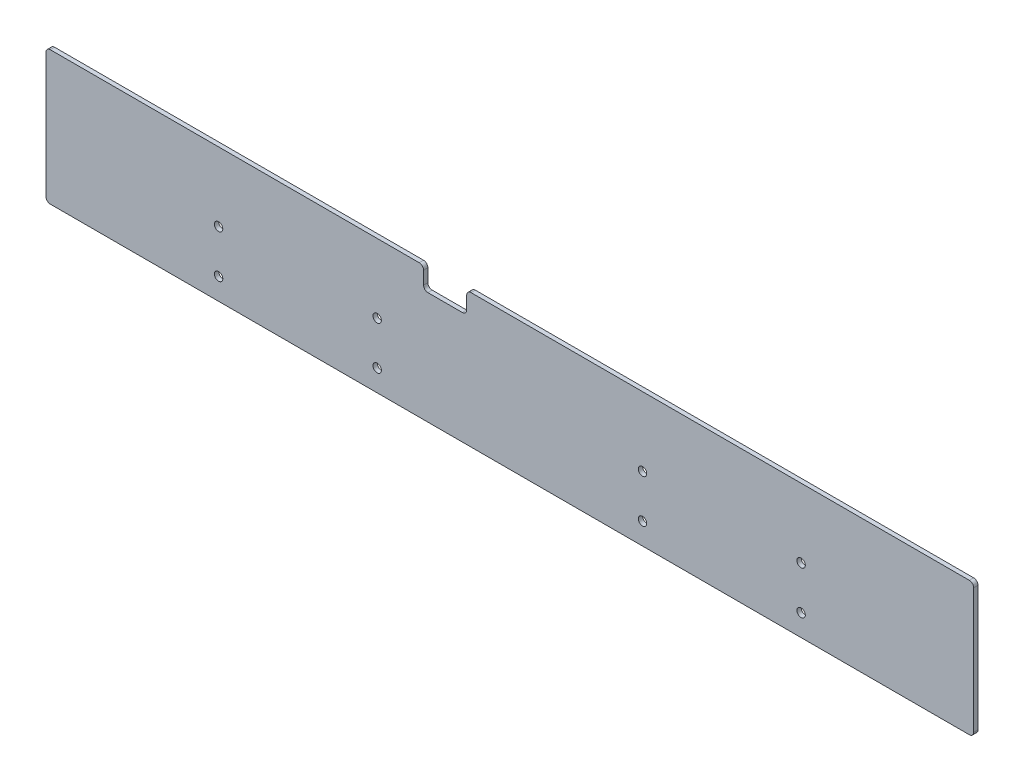
from build123d import *

# Parameters (mm, degrees)
SKETCH1_R           = 1.95
BOSS_EXTRUDE1_DEPTH = 2
FILLET1_R           = 2
SKETCH2_R           = 1.95
CUT_EXTRUDE1_DEPTH  = 10


with BuildPart() as part:
    # Sketch1 → Boss-Extrude1 (new body)
    with BuildSketch(Plane.XY):
        Polygon((-161.905896291, 17.703517588), (73.094103709, 17.703517588), (73.094103709, -44.296482412), (-356.905896291, -44.296482412), (-356.905896291, 17.703517588), (-181.905896291, 17.703517588), (-181.905896291, 7.703517588), (-161.905896291, 7.703517588), align=None)
        with Locations((-80.405896291, -14.296482412)):
            Circle(SKETCH1_R, mode=Mode.SUBTRACT)
        with Locations((-80.405896291, -34.296482412)):
            Circle(SKETCH1_R, mode=Mode.SUBTRACT)
        with Locations((-203.405896291, -14.296482412)):
            Circle(SKETCH1_R, mode=Mode.SUBTRACT)
        with Locations((-203.405896291, -34.296482412)):
            Circle(SKETCH1_R, mode=Mode.SUBTRACT)
    extrude(amount=BOSS_EXTRUDE1_DEPTH)

    # Fillet1
    fillet1_edges = [part.edges().sort_by_distance(p)[0] for p in [
        (73.094103709, -44.296482412, 1),
        (-356.905896291, -44.296482412, 1),
        (-356.905896291, 17.703517588, 1),
        (-181.905896291, 7.703517588, 1),
        (-181.905896291, 17.703517588, 1),
        (-161.905896291, 7.703517588, 1),
        (-161.905896291, 17.703517588, 1),
        (73.094103709, 17.703517588, 1),
    ]]
    fillet(fillet1_edges, radius=FILLET1_R)

    # Sketch2 → Cut-Extrude1 (cut)
    with BuildSketch(Plane.XY.offset(2)):
        with Locations((-276.905896291, -14.296482412)):
            Circle(SKETCH2_R)
        with Locations((-276.905896291, -34.296482412)):
            Circle(SKETCH2_R)
        with Locations((-6.905896291, -14.296482412)):
            Circle(SKETCH2_R)
        with Locations((-6.905896291, -34.296482412)):
            Circle(SKETCH2_R)
    extrude(amount=-CUT_EXTRUDE1_DEPTH, mode=Mode.SUBTRACT)


solid = part.part
